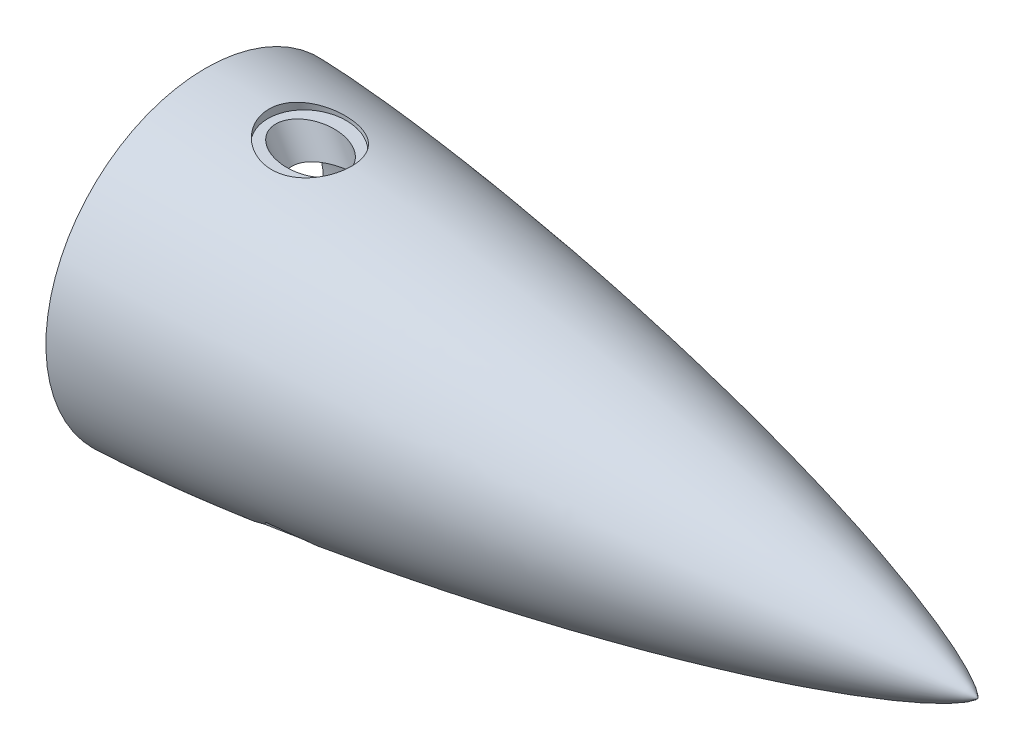
from build123d import *

# Parameters (mm, degrees)
SKETCH26_R                        = 15
CUT_EXTRUDE5_DEPTH                = 50
SKETCH30_R                        = 22
CUT_EXTRUDE10_DEPTH               = 5
TAP_DRILL_FOR_1_4_HELICOIL1_D     = 6.7564
TAP_DRILL_FOR_1_4_HELICOIL1_DEPTH = 20
CIRPATTERN1_COUNT                 = 6


with BuildPart() as part:
    # Sketch10 → Revolve1 (revolve)
    with BuildSketch(Plane.XY):
        with BuildLine():
            Line((0.395312527, 69.55), (0.395312527, 64.55))
            Line((0.395312527, 64.55), (0.395312527, 62.55))
            Line((0.395312527, 62.55), (136.930958491, 62.55))
            add(Edge.make_bspline(
                [(389.481241764, 0), (389.478956828, 0.012281237), (389.472423009, 0.036293357), (389.452394234, 0.082214601), (389.412029369, 0.156923688), (389.352810512, 0.246890788), (389.259583296, 0.370702179), (389.115955477, 0.538679975), (388.885647023, 0.77776911), (388.491524927, 1.138579873), (387.81258233, 1.685384145), (386.620779259, 2.525195366), (384.501598851, 3.826886485), (380.779874736, 5.807755977), (374.677841834, 8.621490545), (364.201125064, 12.82934555), (349.163706015, 18.045749022), (330.274296251, 23.807572601), (308.42174104, 29.754442685), (285.900401017, 35.320411808), (263.276345509, 40.451784793), (240.570241723, 45.205155996), (217.794783038, 49.613887741), (194.959025546, 53.698143573), (174.930289765, 56.995658957), (157.73171832, 59.624749713), (146.075009293, 61.294733697), (140.154997407, 62.112949954), (137.106286782, 62.526257757), (136.930958491, 62.55)],
                knots=[0, 0, 0, 0, 0, 0.000134949, 0.000269899, 0.000539798, 0.000919537, 0.001299277, 0.001947431, 0.00293136, 0.004511869, 0.007081312, 0.011380263, 0.018707867, 0.031423867, 0.052705479, 0.084103008, 0.140910136, 0.203703492, 0.266497064, 0.329290816, 0.392084375, 0.454877964, 0.517671564, 0.580465191, 0.643258828, 0.674655593, 0.706052358, 0.707968088, 0.707968088, 0.707968088, 0.707968088, 0.707968088], degree=4))
            Line((389.481241764, 0), (409.481241764, 0))
            add(Edge.make_bspline(
                [(409.481241764, 0), (409.478822602, 0.013487485), (409.471791677, 0.039860166), (409.44996872, 0.090299923), (409.405170369, 0.17360441), (409.338622841, 0.274707126), (409.233198984, 0.41435486), (409.071473276, 0.602630626), (408.814393211, 0.868443814), (408.376034855, 1.268699656), (407.623681971, 1.874044786), (406.300886659, 2.80689474), (403.950805973, 4.254089379), (399.800317204, 6.473924098), (392.936954952, 9.659940464), (381.088920065, 14.458133958), (364.027881021, 20.439719136), (342.565783158, 27.076024485), (317.737377085, 33.948483164), (292.149117176, 40.40246553), (266.444005618, 46.372709865), (240.645313143, 51.922660722), (214.767260005, 57.089687778), (188.820024567, 61.896435261), (166.061529058, 65.795828503), (146.518269237, 68.91929539), (130.209185955, 71.372758968), (117.148436808, 73.24373966), (104.074432981, 75.019811614), (92.623234339, 76.487170689), (82.799789073, 77.679439415), (74.608164803, 78.626986039), (68.051597153, 79.356294804), (61.491752048, 80.05557077), (54.928607929, 80.723256072), (48.362151485, 81.357482811), (41.792344871, 81.955972251), (36.040789439, 82.445886318), (31.108722933, 82.839416847), (26.997195352, 83.148219974), (23.707077769, 83.383057729), (20.091694532, 83.626627241), (16.724439325, 83.837024008), (13.60553361, 84.016286235), (10.735186496, 84.166698043), (8.43841491, 84.277064727), (6.141138628, 84.376754941), (4.13054718, 84.451863988), (2.40683331, 84.506841756), (1.257457843, 84.534358411), (0.682722204, 84.546806796), (0.395312527, 84.55)],
                knots=[0, 0, 0, 0, 0, 0.000130123, 0.000260245, 0.000520491, 0.000900391, 0.00128029, 0.001925099, 0.002881508, 0.004418208, 0.006927086, 0.011110697, 0.018279138, 0.03067276, 0.051704469, 0.08310228, 0.139908797, 0.202702513, 0.265496165, 0.328289682, 0.391083359, 0.453876973, 0.516670577, 0.579464197, 0.642257765, 0.673654596, 0.705051427, 0.736448267, 0.767845106, 0.799241874, 0.814940257, 0.830638641, 0.846337073, 0.862035505, 0.877733936, 0.893432368, 0.90913072, 0.924829072, 0.932678248, 0.940527424, 0.9483766, 0.956225776, 0.967169332, 0.97264111, 0.978112888, 0.983584666, 0.989056444, 0.994528222, 0.997264111, 1, 1, 1, 1, 1], degree=4))
            Line((0.395312527, 84.55), (0.395312527, 69.55))
        make_face()
    revolve(axis=Axis((444.766972073, 0, 0), (-1, 0, 0)))

    # Sketch26 → Cut-Extrude5 (cut)
    with BuildSketch(Plane(origin=(-26.195497408, 45.371932441, 0), x_dir=(0, 0, 1), z_dir=(-0.500000000000001, 0.866025403784438, 0))):
        with Locations((0, 86.356135119)):
            Circle(SKETCH26_R)
    extrude(amount=-CUT_EXTRUDE5_DEPTH, mode=Mode.SUBTRACT)

    # Sketch30 → Cut-Extrude10 (cut)
    with BuildSketch(Plane(origin=(8.998922803, 85.619031239, 0), x_dir=(0, 0, 1), z_dir=(0.10452846326764016, 0.9945218953682747, 0))):
        with Locations((0, 47.151115098)):
            Circle(SKETCH30_R)
    extrude(amount=-CUT_EXTRUDE10_DEPTH, mode=Mode.SUBTRACT)

    # Tap Drill for 1/4 Helicoil1
    with Locations(Plane.ZY.offset(-0.395312527)):
        with Locations((-220.84518957, 298.33810159), (0, 69.55)):
            tap_drill_for_1_4_helicoil1 = Hole(TAP_DRILL_FOR_1_4_HELICOIL1_D / 2, depth=TAP_DRILL_FOR_1_4_HELICOIL1_DEPTH)

    # CirPattern1: Tap Drill for 1/4 Helicoil1 ×6 about axis
    cirpattern1_axis = Axis((444.766972073, 0, 0), (-1, 0, 0))
    for i in range(1, CIRPATTERN1_COUNT):
        add(tap_drill_for_1_4_helicoil1.rotate(cirpattern1_axis, i * 360 / CIRPATTERN1_COUNT), mode=Mode.SUBTRACT)


solid = part.part
